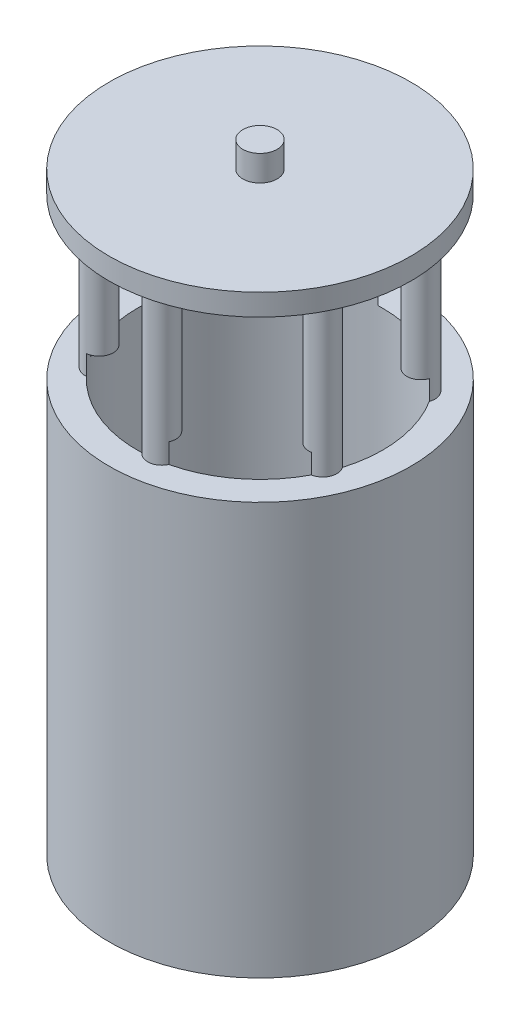
from build123d import *

# Parameters (mm, degrees)
SKETCH1_R           = 27.955
BOSS_EXTRUDE1_DEPTH = 4
SKETCH2_R           = 3.175
BOSS_EXTRUDE2_DEPTH = 4.76
SKETCH3_R           = 2.615316251
BOSS_EXTRUDE3_DEPTH = 29.718
BOSS_EXTRUDE4_START = 76.35
SKETCH4_R           = 27.955
BOSS_EXTRUDE4_DEPTH = 76.35
SKETCH5_R           = 22.758745994
CUT_EXTRUDE1_DEPTH  = 80


with BuildPart() as part:
    # Sketch1 → Boss-Extrude1 (new body)
    with BuildSketch(Plane(origin=(0, 0, 0), x_dir=(1, 0, 0), z_dir=(0, 1, 0))):
        Circle(SKETCH1_R)
    extrude(amount=BOSS_EXTRUDE1_DEPTH)

    # Sketch2 → Boss-Extrude2 (add)
    with BuildSketch(Plane(origin=(0, 4, 0), x_dir=(1, 0, 0), z_dir=(0, 1, 0))):
        Circle(SKETCH2_R)
    extrude(amount=BOSS_EXTRUDE2_DEPTH)

    # Sketch3 → Boss-Extrude3 (add)
    with BuildSketch(Plane.XZ):
        with Locations((19.676080545, 8.041325394)):
            Circle(SKETCH3_R)
        with Locations((16.802032343, -13.019322902)):
            Circle(SKETCH3_R)
        with Locations((2.874048201, 21.060648295)):
            Circle(SKETCH3_R)
        with Locations((-2.874048201, -21.060648295)):
            Circle(SKETCH3_R)
        with Locations((-16.802032343, 13.019322902)):
            Circle(SKETCH3_R)
        with Locations((-19.676080545, -8.041325394)):
            Circle(SKETCH3_R)
    extrude(amount=BOSS_EXTRUDE3_DEPTH)

    # Sketch4 → Boss-Extrude4 (add)
    with BuildSketch(Plane.XZ.offset(29.718).offset(BOSS_EXTRUDE4_START)):
        Circle(SKETCH4_R)
    extrude(amount=-BOSS_EXTRUDE4_DEPTH)

    # Sketch5 → Cut-Extrude1 (cut)
    with BuildSketch(Plane.XZ.offset(106.068)):
        Circle(SKETCH5_R)
    extrude(amount=-CUT_EXTRUDE1_DEPTH, mode=Mode.SUBTRACT)


solid = part.part
